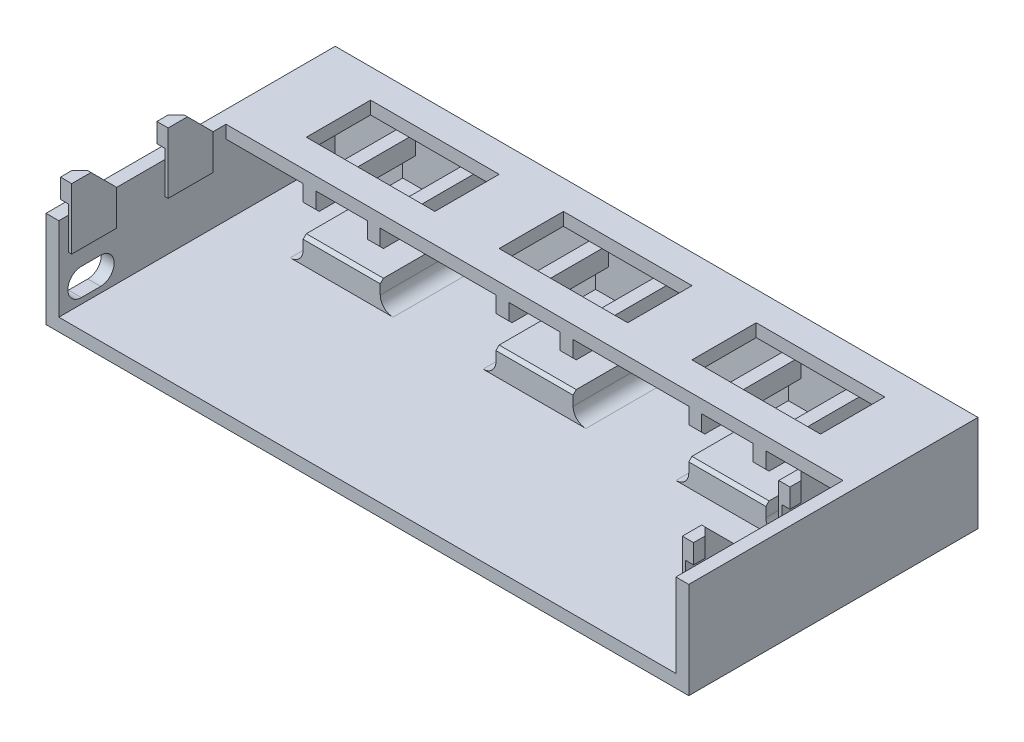
from build123d import *

# Parameters (mm, degrees)
SKETCH1_W                  = 45
SKETCH1_H                  = 15
BOSS_EXTRUDE1_DEPTH        = 50
SKETCH2_W                  = 96
SKETCH2_H                  = 26
CUT_EXTRUDE1_DEPTH         = 13
SHELL1_START               = -48
SHELL1_OUTLINE_W           = 11
SHELL1_OUTLINE_H           = 17
SHELL1_DEPTH               = 96
SKETCH3_W                  = 20
SKETCH3_H                  = 10
CUT_EXTRUDE2_DEPTH         = 2
LPATTERN1_COUNT            = 2
LPATTERN1_PITCH            = 30
LPATTERN1_COL_COUNT        = 2
LPATTERN1_COL_PITCH        = 30
BOSS_EXTRUDE2_REACH        = 68.372
SKETCH4_W                  = 12
SKETCH4_H                  = 4
SKETCH4_W_2                = 2
SKETCH4_H_2                = 3
SKETCH5_W                  = 12
SKETCH5_H                  = 1.5
BOSS_EXTRUDE3_DEPTH        = 7
CHAMFER1_SIZE              = 0.5
FILLET1_R                  = 2
LPATTERN2_COUNT            = 3
LPATTERN2_PITCH            = 30
CHAMFER1_OF_LPATTERN2_SIZE = 0.5
FILLET1_OF_LPATTERN2_R     = 2
SKETCH6_W                  = 3
SKETCH6_H                  = 3
BOSS_EXTRUDE4_DEPTH        = 1.25
BOSS_EXTRUDE4_2_DEPTH      = 1.25
BOSS_EXTRUDE5_DEPTH        = 0.5
SKETCH8_W                  = 7.5
SKETCH8_H                  = 5
BOSS_EXTRUDE6_DEPTH        = 0.5
CHAMFER2_SIZE              = 0.5
CHAMFER4_SIZE              = 1.25
CHAMFER2_OF_MIRROR7_SIZE   = 0.5
CHAMFER4_OF_MIRROR7_SIZE   = 1.25
CUT_EXTRUDE3_DEPTH         = 2


# Read off the part's stored shape, not the designer's step: Shell1
with BuildPart() as part:
    # Sketch1 → Boss-Extrude1 (new, symmetric)
    with BuildSketch(Plane(origin=(0, 0, 0), x_dir=(0, 0, -1), z_dir=(1, 0, 0))):
        Rectangle(SKETCH1_W, SKETCH1_H)
    extrude(amount=BOSS_EXTRUDE1_DEPTH, both=True)

    # Sketch2 → Cut-Extrude1 (cut)
    with BuildSketch(Plane(origin=(0, 7.5, 0), x_dir=(1, 0, 0), z_dir=(0, 1, 0))):
        with Locations((0, -9.5)):
            Rectangle(SKETCH2_W, SKETCH2_H)
    extrude(amount=-CUT_EXTRUDE1_DEPTH, mode=Mode.SUBTRACT)

    # Shell1 outline → Shell1 (cut)
    with BuildSketch(Plane.YZ.offset(SHELL1_START)):
        with Locations((0, -12)):
            Rectangle(SHELL1_OUTLINE_W, SHELL1_OUTLINE_H)
    extrude(amount=SHELL1_DEPTH, mode=Mode.SUBTRACT)

    # Sketch3 → Cut-Extrude2 (cut)
    with BuildSketch(Plane(origin=(0, 7.5, 0), x_dir=(1, 0, 0), z_dir=(0, 1, 0))):
        with Locations((0, 13)):
            Rectangle(SKETCH3_W, SKETCH3_H)
    cut_extrude2 = extrude(amount=-CUT_EXTRUDE2_DEPTH, mode=Mode.SUBTRACT)

    # LPattern1: Cut-Extrude2 ×2
    with Locations(*[(-i * LPATTERN1_PITCH, 0, 0) for i in range(1, LPATTERN1_COUNT)]):
        add(cut_extrude2, mode=Mode.SUBTRACT)

    # LPattern1 col: Cut-Extrude2 ×2
    with Locations(*[(i * LPATTERN1_COL_PITCH, 0, 0) for i in range(1, LPATTERN1_COL_COUNT)]):
        add(cut_extrude2, mode=Mode.SUBTRACT)

    # Boss-Extrude2: up to this face of the body (flat: up to its plane)
    boss_extrude2_end = Plane(part.part.faces().sort_by_distance((0, 6.5, -3.5))[0])
    # Sketch4 → Boss-Extrude2 (add, up to the picked face)
    with BuildSketch(Plane.XY.offset(-20.5), mode=Mode.PRIVATE) as boss_extrude2_sk1:
        with Locations((-30, -3.5)):
            Rectangle(SKETCH4_W, SKETCH4_H)
    boss_extrude2_tool1 = split(extrude(boss_extrude2_sk1.sketch, amount=BOSS_EXTRUDE2_REACH, mode=Mode.PRIVATE), bisect_by=boss_extrude2_end, keep=Keep.BOTH, mode=Mode.PRIVATE)
    # Sketch4 → Boss-Extrude2 (add, up to the picked face)
    with BuildSketch(Plane.XY.offset(-20.5), mode=Mode.PRIVATE) as boss_extrude2_sk2:
        with Locations((-35, 4)):
            Rectangle(SKETCH4_W_2, SKETCH4_H_2)
    boss_extrude2_tool2 = split(extrude(boss_extrude2_sk2.sketch, amount=BOSS_EXTRUDE2_REACH, mode=Mode.PRIVATE), bisect_by=boss_extrude2_end, keep=Keep.BOTH, mode=Mode.PRIVATE)
    # Sketch4 → Boss-Extrude2 (add, up to the picked face)
    with BuildSketch(Plane.XY.offset(-20.5), mode=Mode.PRIVATE) as boss_extrude2_sk3:
        with Locations((-25, 4)):
            Rectangle(SKETCH4_W_2, SKETCH4_H_2)
    boss_extrude2_tool3 = split(extrude(boss_extrude2_sk3.sketch, amount=BOSS_EXTRUDE2_REACH, mode=Mode.PRIVATE), bisect_by=boss_extrude2_end, keep=Keep.BOTH, mode=Mode.PRIVATE)
    boss_extrude2_1 = boss_extrude2_tool1.solids().sort_by(Axis((-30, -3.5, -20.5), (0, 0, 1)))[0]
    add(boss_extrude2_1)
    boss_extrude2_2 = boss_extrude2_tool2.solids().sort_by(Axis((-35, 4, -20.5), (0, 0, 1)))[0]
    add(boss_extrude2_2)
    boss_extrude2_3 = boss_extrude2_tool3.solids().sort_by(Axis((-25, 4, -20.5), (0, 0, 1)))[0]
    add(boss_extrude2_3)
    boss_extrude2 = boss_extrude2_1 + boss_extrude2_2 + boss_extrude2_3  # Boss-Extrude2 as one shape, for the pattern or mirror that repeats it

    # Sketch5 → Boss-Extrude3 (add)
    with BuildSketch(Plane(origin=(0, -1.5, 0), x_dir=(1, 0, 0), z_dir=(0, 1, 0))):
        with Locations((-30, 19.75)):
            Rectangle(SKETCH5_W, SKETCH5_H)
    boss_extrude3 = extrude(amount=BOSS_EXTRUDE3_DEPTH)

    # Chamfer1
    chamfer1_edges = [part.edges().sort_by_distance(p)[0] for p in [
        (-35, 2.5, -3.5),
        (-25, 2.5, -3.5),
        (-30, -1.5, -3.5),
    ]]
    chamfer(chamfer1_edges, length=CHAMFER1_SIZE)

    # Fillet1
    fillet1_edges = [part.edges().sort_by_distance(p)[0] for p in [
        (-24, -5.5, -12),
        (-36, -5.5, -12),
    ]]
    fillet(fillet1_edges, radius=FILLET1_R)

    # LPattern2: Boss-Extrude2, Boss-Extrude3 ×3
    with Locations(*[(i * LPATTERN2_PITCH, 0, 0) for i in range(1, LPATTERN2_COUNT)]):
        add(boss_extrude2)
        add(boss_extrude3)

    # Chamfer1 of LPattern2
    chamfer1_of_lpattern2_edges = [part.edges().sort_by_distance(p)[0] for p in [
        (-5, 2.5, -3.5),
        (5, 2.5, -3.5),
        (0, -1.5, -3.5),
        (25, 2.5, -3.5),
        (35, 2.5, -3.5),
        (30, -1.5, -3.5),
    ]]
    chamfer(chamfer1_of_lpattern2_edges, length=CHAMFER1_OF_LPATTERN2_SIZE)

    # Fillet1 of LPattern2
    fillet1_of_lpattern2_edges = [part.edges().sort_by_distance(p)[0] for p in [
        (6, -5.5, -12),
        (-6, -5.5, -12),
        (36, -5.5, -12),
        (24, -5.5, -12),
    ]]
    fillet(fillet1_of_lpattern2_edges, radius=FILLET1_OF_LPATTERN2_R)



with BuildPart() as body_2:
    # Sketch6 → Boss-Extrude4 (new body)
    with BuildSketch(Plane.ZY.offset(-48)):
        with Locations((19.5, 10.5)):
            Rectangle(SKETCH6_W, SKETCH6_H)
    boss_extrude4 = extrude(amount=-BOSS_EXTRUDE4_DEPTH)



with BuildPart() as body_3:
    # Sketch6 → Boss-Extrude4 2 (new body)
    with BuildSketch(Plane.ZY.offset(-48)):
        with Locations((4.5, 10.5)):
            Rectangle(SKETCH6_W, SKETCH6_H)
    boss_extrude4_2 = extrude(amount=-BOSS_EXTRUDE4_2_DEPTH)


with BuildPart() as body_2_1:
    add(body_2.part)

    add(body_3.part)  # Boss-Extrude5 merges body 3
    # Sketch7 → Boss-Extrude5 (add)
    with BuildSketch(Plane.ZY.offset(-48)):
        Polygon((18, 12), (13.5, 7.5), (21, 7.5), (21, 12), align=None)
        Polygon((3, 12), (-1.5, 7.5), (6, 7.5), (6, 12), align=None)
    boss_extrude5 = extrude(amount=BOSS_EXTRUDE5_DEPTH)


with BuildPart() as part_1:
    add(part.part)

    add(body_2_1.part)  # Boss-Extrude6 merges body 2
    # Sketch8 → Boss-Extrude6 (add)
    with BuildSketch(Plane.ZY.offset(-47.5)):
        with Locations((2.25, 5)):
            Rectangle(SKETCH8_W, SKETCH8_H)
        with Locations((17.25, 5)):
            Rectangle(SKETCH8_W, SKETCH8_H)
    boss_extrude6 = extrude(amount=-BOSS_EXTRUDE6_DEPTH)

    # Chamfer2
    chamfer2_edges = [part_1.edges().sort_by_distance(p)[0] for p in [
        (47.5, 5, -1.5),
        (47.5, 5, 13.5),
    ]]
    chamfer(chamfer2_edges, length=CHAMFER2_SIZE - 0.0001)  # a hair under: the kernel refuses the full size

    # Chamfer4
    chamfer4_edges = [part_1.edges().sort_by_distance(p)[0] for p in [
        (49.25, 10.5, 3),
        (49.25, 10.5, 18),
    ]]
    chamfer(chamfer4_edges, length=CHAMFER4_SIZE - 0.0001)  # a hair under: the kernel refuses the full size

    # Mirror7: Boss-Extrude4, Boss-Extrude4 2, Boss-Extrude5, Boss-Extrude6 across plane
    add(boss_extrude4.mirror(Plane(origin=(0, 0, 0), x_dir=(0, 0, 1), z_dir=(1, 0, 0))))
    add(boss_extrude4_2.mirror(Plane(origin=(0, 0, 0), x_dir=(0, 0, 1), z_dir=(1, 0, 0))))
    add(boss_extrude5.mirror(Plane(origin=(0, 0, 0), x_dir=(0, 0, 1), z_dir=(1, 0, 0))))
    add(boss_extrude6.mirror(Plane(origin=(0, 0, 0), x_dir=(0, 0, 1), z_dir=(1, 0, 0))))

    # Chamfer2 of Mirror7
    chamfer2_of_mirror7_edges = [part_1.edges().sort_by_distance(p)[0] for p in [
        (-47.5, 5, -1.5),
        (-47.5, 5, 13.5),
    ]]
    chamfer(chamfer2_of_mirror7_edges, length=CHAMFER2_OF_MIRROR7_SIZE - 0.0001)  # a hair under: the kernel refuses the full size

    # Chamfer4 of Mirror7
    chamfer4_of_mirror7_edges = [part_1.edges().sort_by_distance(p)[0] for p in [
        (-49.25, 10.5, 3),
        (-49.25, 10.5, 18),
    ]]
    chamfer(chamfer4_of_mirror7_edges, length=CHAMFER4_OF_MIRROR7_SIZE - 0.0001)  # a hair under: the kernel refuses the full size

    # Sketch10 → Cut-Extrude3 (cut)
    with BuildSketch(Plane.ZY.offset(50)):
        with BuildLine():
            Line((19, -4.6), (16, -4.6))
            ThreePointArc((16, -4.6), (13.9, -2.5), (16, -0.4))
            Line((16, -0.4), (19, -0.4))
            ThreePointArc((19, -0.4), (21.1, -2.5), (19, -4.6))
        make_face()
    extrude(amount=-CUT_EXTRUDE3_DEPTH, mode=Mode.SUBTRACT)


solid = part_1.part
